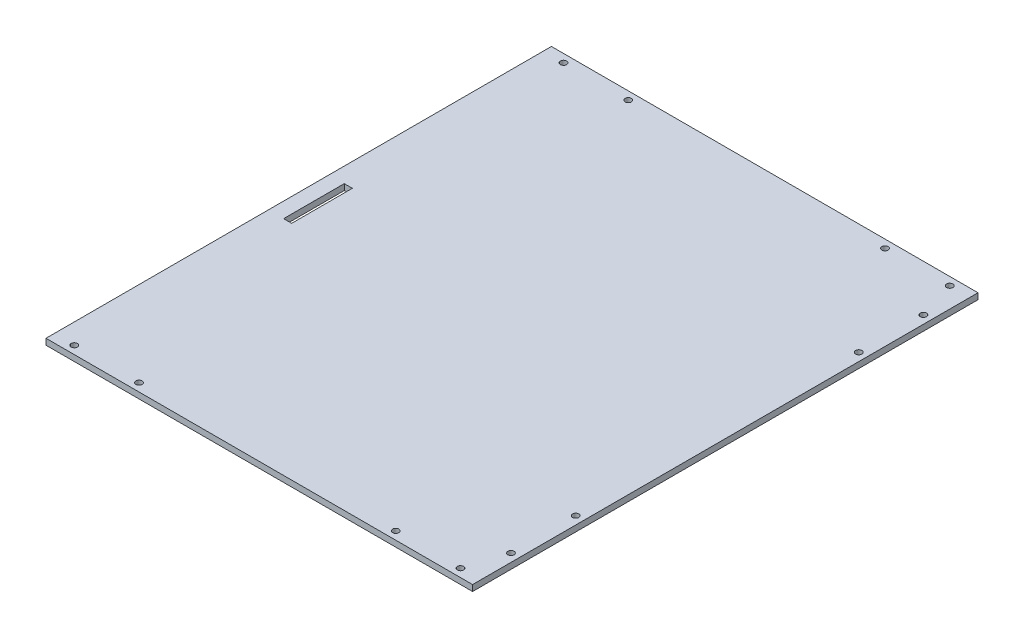
from build123d import *

# Parameters (mm, degrees)
SKETCH1_W           = 211
SKETCH1_H           = 250
SKETCH1_R           = 1.55
SKETCH1_W_2         = 4
SKETCH1_H_2         = 30
BOSS_EXTRUDE1_DEPTH = 3


with BuildPart() as part:
    # Sketch1 → Boss-Extrude1 (new body)
    with BuildSketch(Plane(origin=(0, 0, 0), x_dir=(1, 0, 0), z_dir=(0, 1, 0))):
        with Locations((105.5, 125)):
            Rectangle(SKETCH1_W, SKETCH1_H)
        with Locations((10, 4)):
            Circle(SKETCH1_R, mode=Mode.SUBTRACT)
        with Locations((42, 4)):
            Circle(SKETCH1_R, mode=Mode.SUBTRACT)
        with Locations((42, 246)):
            Circle(SKETCH1_R, mode=Mode.SUBTRACT)
        with Locations((10, 246)):
            Circle(SKETCH1_R, mode=Mode.SUBTRACT)
        with Locations((169, 4)):
            Circle(SKETCH1_R, mode=Mode.SUBTRACT)
        with Locations((201, 4)):
            Circle(SKETCH1_R, mode=Mode.SUBTRACT)
        with Locations((169, 246)):
            Circle(SKETCH1_R, mode=Mode.SUBTRACT)
        with Locations((201, 246)):
            Circle(SKETCH1_R, mode=Mode.SUBTRACT)
        with Locations((207, 23)):
            Circle(SKETCH1_R, mode=Mode.SUBTRACT)
        with Locations((207, 55)):
            Circle(SKETCH1_R, mode=Mode.SUBTRACT)
        with Locations((207, 227)):
            Circle(SKETCH1_R, mode=Mode.SUBTRACT)
        with Locations((207, 195)):
            Circle(SKETCH1_R, mode=Mode.SUBTRACT)
        with Locations((9.525, 125)):
            Rectangle(SKETCH1_W_2, SKETCH1_H_2, mode=Mode.SUBTRACT)
    extrude(amount=BOSS_EXTRUDE1_DEPTH)


solid = part.part
